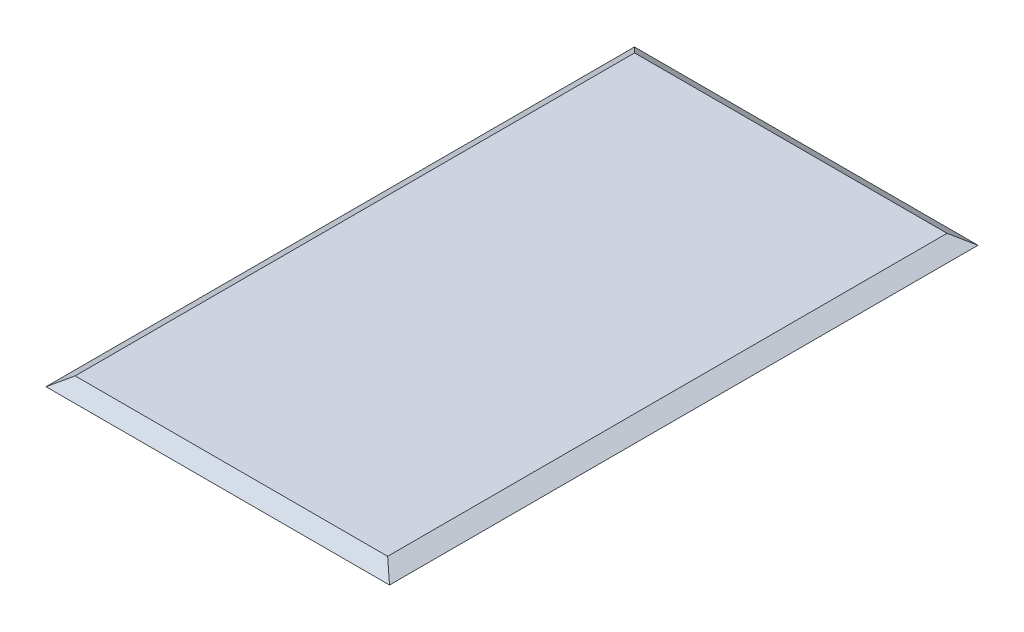
from build123d import *

# Parameters (mm, degrees)
SKETCH_1_W          = 3298.067470497
SKETCH_1_H          = 5650
EXTRUDE_1_DEPTH     = 90
SKETCH_2_OUTSIDE_W  = 4608.621
SKETCH_2_OUTSIDE_H  = 1400.554
CUT_EXTRUDE_1_DEPTH = 6543.7707464
SKETCH_3_OUTSIDE_W  = 6960.554
SKETCH_3_OUTSIDE_H  = 1400.554
CUT_EXTRUDE_4_DEPTH = 6543.7707464
SKETCH_4_W          = 3000
SKETCH_4_H          = 5390
CUT_EXTRUDE_5_DEPTH = 60


with BuildPart() as part:
    # Эскиз1 → Бобышка-Вытянуть1 (new body)
    with BuildSketch(Plane(origin=(0, 0, 0), x_dir=(1, 0, 0), z_dir=(0, 1, 0))):
        with Locations((1649.033735249, 2825)):
            Rectangle(SKETCH_1_W, SKETCH_1_H)
    extrude(amount=EXTRUDE_1_DEPTH)

    # Эскиз2 outside → Вырез-Вытянуть1 (cut, through all)
    with BuildSketch(Plane.XY):
        with Locations((1649.0335, 45)):
            Rectangle(SKETCH_2_OUTSIDE_W, SKETCH_2_OUTSIDE_H)
        Polygon((0, 0), (140, 90), (3140, 90), (3298.067470497, 0), align=None, mode=Mode.SUBTRACT)
    extrude(amount=-CUT_EXTRUDE_1_DEPTH, mode=Mode.SUBTRACT)

    # Эскиз3 outside → Вырез-Вытянуть4 (cut, through all)
    with BuildSketch(Plane(origin=(0, 0, 0), x_dir=(0, 0, -1), z_dir=(1, 0, 0))):
        with Locations((2825, 45)):
            Rectangle(SKETCH_3_OUTSIDE_W, SKETCH_3_OUTSIDE_H)
        Polygon((0, 0), (140, 90), (5510.895976381, 90), (5650, 0), align=None, mode=Mode.SUBTRACT)
    extrude(amount=CUT_EXTRUDE_4_DEPTH, mode=Mode.SUBTRACT)

    # Эскиз4 → Вырез-Вытянуть5 (cut)
    with BuildSketch(Plane.XZ):
        with Locations((1640, -2835)):
            Rectangle(SKETCH_4_W, SKETCH_4_H)
    extrude(amount=-CUT_EXTRUDE_5_DEPTH, mode=Mode.SUBTRACT)


solid = part.part
